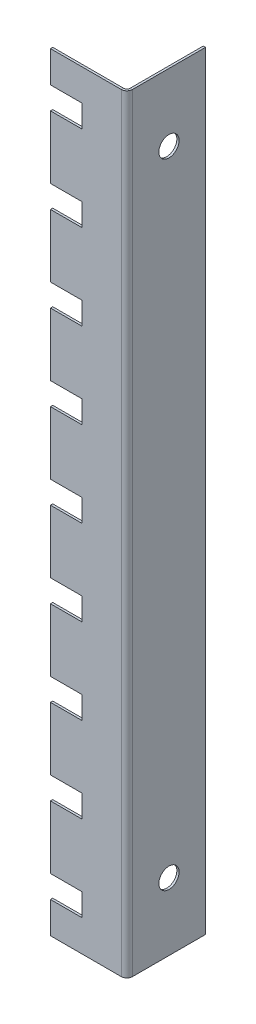
from build123d import *

# Parameters (mm, degrees)
T_LE_DE_BASE_PLI_E1_DEPTH             = 0.5
T_LE_PLI_E_SUR_AR_TE1_STRIP_W         = 3.4732
T_LE_PLI_E_SUR_AR_TE1_STRIP_H         = 0.5
T_LE_PLI_E_SUR_AR_TE1_STRIP_CUT_DEPTH = 171
T_LE_PLI_E_SUR_AR_TE1_DEPTH           = 171
PER_AGE1_START                        = -0.5
PER_AGE1_OUTLINE_R                    = 2.25
PER_AGE1_DEPTH                        = 0.5


# Read off the part's stored shape, not the designer's step: Perçage1
# Sheet-metal steps are written as plain solids
with BuildPart() as part:
    # Esquisse1 → Tôle de base pliée1 (new body)
    with BuildSketch(Plane.XY):
        Polygon((0, -85.5), (-17, -85.5), (-17, -78.5), (-10, -78.5), (-10, -73.5), (-17, -73.5), (-17, -59.5), (-10, -59.5), (-10, -54.5), (-17, -54.5), (-17, -40.5), (-10, -40.5), (-10, -35.5), (-17, -35.5), (-17, -21.5), (-10, -21.5), (-10, -16.5), (-17, -16.5), (-17, -2.5), (-10, -2.5), (-10, 2.5), (-17, 2.5), (-17, 16.5), (-10, 16.5), (-10, 21.5), (-17, 21.5), (-17, 35.5), (-10, 35.5), (-10, 40.5), (-17, 40.5), (-17, 54.5), (-10, 54.5), (-10, 59.5), (-17, 59.5), (-17, 73.5), (-10, 73.5), (-10, 78.5), (-17, 78.5), (-17, 85.5), (0, 85.5), align=None)
    extrude(amount=-T_LE_DE_BASE_PLI_E1_DEPTH)

    # Tôle pliée sur arête1 strip (across the edge) → Tôle pliée sur arête1 strip cut (cut)
    with BuildSketch(Plane(origin=(0, 85.5, -0.5), x_dir=(-1, 0, 0), z_dir=(0, -1, 0))):
        with Locations((-0.5, -0.25)):
            Rectangle(T_LE_PLI_E_SUR_AR_TE1_STRIP_W, T_LE_PLI_E_SUR_AR_TE1_STRIP_H)
    extrude(amount=T_LE_PLI_E_SUR_AR_TE1_STRIP_CUT_DEPTH, mode=Mode.SUBTRACT)

    # Tôle pliée sur arête1 section (across the edge) → Tôle pliée sur arête1 (add)
    with BuildSketch(Plane(origin=(0, 85.5, -0.5), x_dir=(-1, 0, 0), z_dir=(0, -1, 0))):
        with BuildLine():
            Line((0, 0.7366), (0, 17))
            Line((0, 17), (0.5, 17))
            Line((0.5, 17), (0.5, 0.7366))
            ThreePointArc((0.5, 0.7366), (0.715745145, 0.215745145), (1.2366, 0))
            Line((1.2366, 0), (1.2366, -0.5))
            ThreePointArc((1.2366, -0.5), (0.362191754, -0.137808246), (0, 0.7366))
        make_face()
    extrude(amount=T_LE_PLI_E_SUR_AR_TE1_DEPTH)

    # Perçage1 outline → Perçage1 (cut)
    with BuildSketch(Plane.YZ.offset(PER_AGE1_START)):
        with Locations((-70.5, -9.3683)):
            Circle(PER_AGE1_OUTLINE_R)
        with Locations((70.5, -9.3683)):
            Circle(PER_AGE1_OUTLINE_R)
    extrude(amount=PER_AGE1_DEPTH, mode=Mode.SUBTRACT)


solid = part.part
